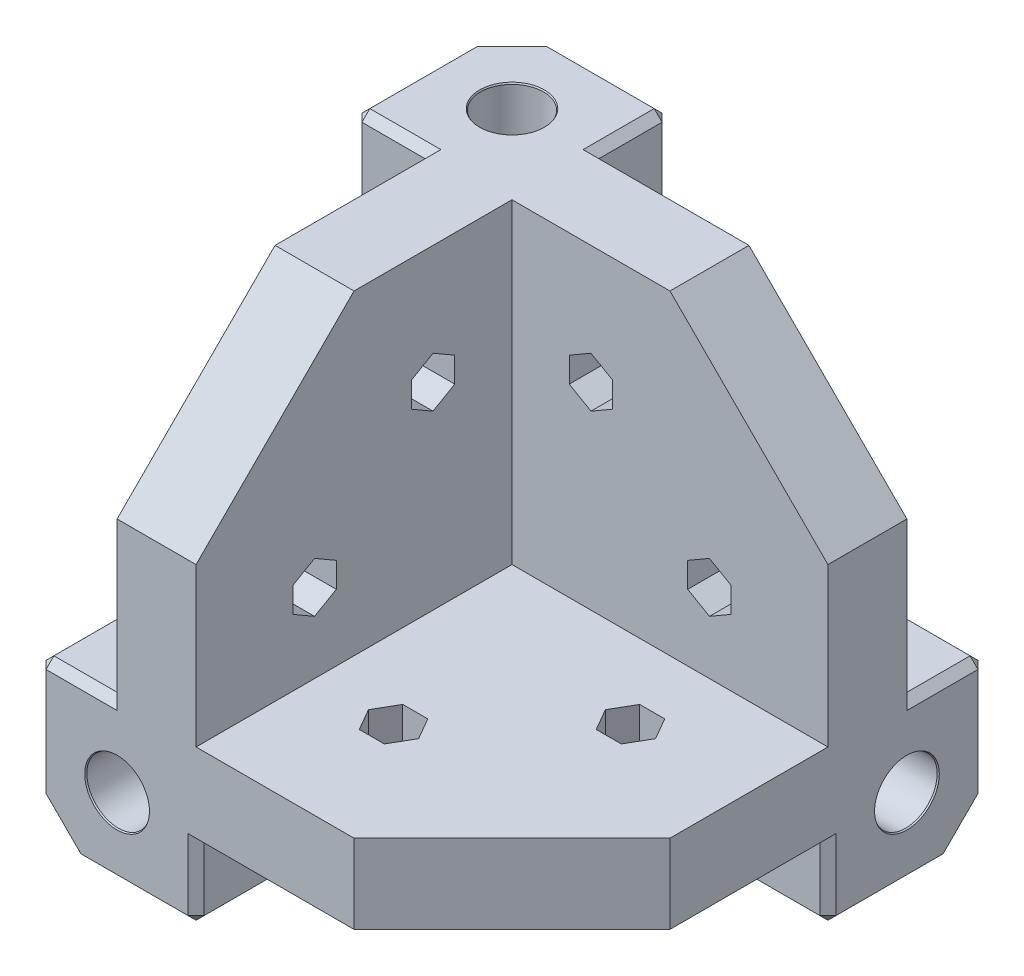
from build123d import *

# Parameters (mm, degrees)
BASE_SHAPE_BASE_DEPTH        = 20
BASE_SHAPE_EXTENSION_DEPTH   = 40
BASE_SHAPE_FINISH_SKETCH_W   = 10
BASE_SHAPE_FINISH_SKETCH_H   = 40
BASE_SHAPE_FINISH_DEPTH      = 40
ROD_HOLE_D8_Z_D              = 8
ROD_HOLE_D8_Z_DEPTH          = 40
ROD_HOLE_D8_Z_CSINK_D        = 8.2
ROD_HOLE_D8_Z_CSINK_ANGLE    = 60
ROD_HOLE_D8_Z_TIP            = 2.403442476
ROD_HOLE_D8_X_D              = 8
ROD_HOLE_D8_X_DEPTH          = 40
ROD_HOLE_D8_X_CSINK_D        = 8.2
ROD_HOLE_D8_X_CSINK_ANGLE    = 60
ROD_HOLE_D8_X_TIP            = 2.403442476
ROD_HOLE_D8_Y_D              = 8
ROD_HOLE_D8_Y_DEPTH          = 40
ROD_HOLE_D8_Y_CSINK_D        = 8.2
ROD_HOLE_D8_Y_CSINK_ANGLE    = 60
ROD_HOLE_D8_Y_TIP            = 2.403442476
OUTER_CHAMFERS_SIZE          = 5
INNER_SMALLER_CHAMFERS_SIZE  = 1
LARGE_CHAMFERS_SIZE          = 20
HULL_PART_HOLES_M3_START     = 10
HULL_PART_HOLES_M3_OUTLINE_R = 1.7
HULL_PART_HOLES_M3_DEPTH     = 10
HULL_PART_NUT_HOLE_DEPTH     = 5


# Read off the part's stored shape, not the designer's step: hull_part_holes_m3
with BuildPart() as part:
    # base_shape_sketch → base_shape_base (new body)
    with BuildSketch(Plane.XY):
        Polygon((0, 0), (60, 0), (60, 20), (20, 20), (20, 60), (0, 60), align=None)
    extrude(amount=BASE_SHAPE_BASE_DEPTH)

    # base_shape_extension_sketch → base_shape_extension (add)
    with BuildSketch(Plane.XY.offset(20)):
        Polygon((20, 60), (20, 20), (60, 20), (60, 10), (20, 10), (20, 0), (0, 0), (0, 20), (10, 20), (10, 60), align=None)
    extrude(amount=BASE_SHAPE_EXTENSION_DEPTH)

    # base_shape_finish_sketch → base_shape_finish (add)
    with BuildSketch(Plane(origin=(20, 0, 0), x_dir=(0, 0, -1), z_dir=(1, 0, 0))):
        with Locations((-15, 40)):
            Rectangle(BASE_SHAPE_FINISH_SKETCH_W, BASE_SHAPE_FINISH_SKETCH_H)
    extrude(amount=BASE_SHAPE_FINISH_DEPTH)

    # rod_hole_d8_z
    with Locations(Plane.XY.offset(60)):
        with Locations((10, 10)):
            CounterSinkHole(ROD_HOLE_D8_Z_D / 2, ROD_HOLE_D8_Z_CSINK_D / 2, depth=ROD_HOLE_D8_Z_DEPTH, counter_sink_angle=ROD_HOLE_D8_Z_CSINK_ANGLE)
            with Locations((0, 0, -(ROD_HOLE_D8_Z_DEPTH + ROD_HOLE_D8_Z_TIP / 2))):  # 118° drill point
                Cone(0, ROD_HOLE_D8_Z_D / 2, ROD_HOLE_D8_Z_TIP, mode=Mode.SUBTRACT)

    # rod_hole_d8_x
    with Locations(Plane(origin=(60, 0, 0), x_dir=(0, 0, -1), z_dir=(1, 0, 0))):
        with Locations((-10, 10)):
            CounterSinkHole(ROD_HOLE_D8_X_D / 2, ROD_HOLE_D8_X_CSINK_D / 2, depth=ROD_HOLE_D8_X_DEPTH, counter_sink_angle=ROD_HOLE_D8_X_CSINK_ANGLE)
            with Locations((0, 0, -(ROD_HOLE_D8_X_DEPTH + ROD_HOLE_D8_X_TIP / 2))):  # 118° drill point
                Cone(0, ROD_HOLE_D8_X_D / 2, ROD_HOLE_D8_X_TIP, mode=Mode.SUBTRACT)

    # rod_hole_d8_y
    with Locations(Plane(origin=(0, 60, 0), x_dir=(1, 0, 0), z_dir=(0, 1, 0))):
        with Locations((10, -10)):
            CounterSinkHole(ROD_HOLE_D8_Y_D / 2, ROD_HOLE_D8_Y_CSINK_D / 2, depth=ROD_HOLE_D8_Y_DEPTH, counter_sink_angle=ROD_HOLE_D8_Y_CSINK_ANGLE)
            with Locations((0, 0, -(ROD_HOLE_D8_Y_DEPTH + ROD_HOLE_D8_Y_TIP / 2))):  # 118° drill point
                Cone(0, ROD_HOLE_D8_Y_D / 2, ROD_HOLE_D8_Y_TIP, mode=Mode.SUBTRACT)

    # outer_chamfers
    outer_chamfers_edges = [part.edges().sort_by_distance(p)[0] for p in [
        (0, 0, 30),
        (30, 0, 0),
        (0, 30, 0),
    ]]
    chamfer(outer_chamfers_edges, length=OUTER_CHAMFERS_SIZE)

    # inner_smaller_chamfers
    inner_smaller_chamfers_edges = [part.edges().sort_by_distance(p)[0] for p in [
        (0, 60, 12.5),
        (60, 0, 12.5),
        (60, 5, 20),
        (40, 0, 20),
        (5, 60, 20),
        (0, 20, 40),
        (20, 0, 40),
        (5, 20, 60),
        (0, 12.5, 60),
        (20, 5, 60),
        (20, 60, 5),
        (0, 40, 20),
        (60, 20, 5),
        (12.5, 60, 0),
        (20, 40, 0),
        (40, 20, 0),
        (12.5, 0, 60),
        (2.5, 2.5, 60),
        (60, 12.5, 0),
        (60, 2.5, 2.5),
        (2.5, 60, 2.5),
    ]]
    chamfer(inner_smaller_chamfers_edges, length=INNER_SMALLER_CHAMFERS_SIZE)

    # large_chamfers
    large_chamfers_edges = [part.edges().sort_by_distance(p)[0] for p in [
        (15, 60, 60),
        (60, 15, 60),
        (60, 60, 15),
    ]]
    chamfer(large_chamfers_edges, length=LARGE_CHAMFERS_SIZE)

    # hull_part_holes_m3 outline → hull_part_holes_m3 (cut)
    with BuildSketch(Plane.YZ.offset(HULL_PART_HOLES_M3_START)):
        with Locations((45, 30)):
            Circle(HULL_PART_HOLES_M3_OUTLINE_R)
        with Locations((30, 45)):
            Circle(HULL_PART_HOLES_M3_OUTLINE_R)
    hull_part_holes_m3 = extrude(amount=HULL_PART_HOLES_M3_DEPTH, mode=Mode.SUBTRACT)

    # Sketch12 → hull_part_nut_hole (cut)
    with BuildSketch(Plane(origin=(20, 0, 0), x_dir=(0, 0, -1), z_dir=(1, 0, 0))):
        Polygon((-30, 48.175426481), (-32.75, 46.58771324), (-32.75, 43.41228676), (-30, 41.824573519), (-27.25, 43.41228676), (-27.25, 46.58771324), align=None)
        Polygon((-45, 33.175426481), (-47.75, 31.58771324), (-47.75, 28.41228676), (-45, 26.824573519), (-42.25, 28.41228676), (-42.25, 31.58771324), align=None)
    hull_part_nut_hole = extrude(amount=-HULL_PART_NUT_HOLE_DEPTH, mode=Mode.SUBTRACT)

    # hull_part_holes_mirror_x: hull_part_holes_m3, hull_part_nut_hole across plane
    add(hull_part_holes_m3.mirror(Plane(origin=(0, 0, 0), x_dir=(0.7071067811865482, 0, 0.7071067811865468), z_dir=(-0.707106781186547, 0, 0.7071067811865481))), mode=Mode.SUBTRACT)
    add(hull_part_nut_hole.mirror(Plane(origin=(0, 0, 0), x_dir=(0.7071067811865482, 0, 0.7071067811865468), z_dir=(-0.707106781186547, 0, 0.7071067811865481))), mode=Mode.SUBTRACT)

    # hull_part_holes_mirror_y: hull_part_holes_m3, hull_part_nut_hole across plane
    add(hull_part_holes_m3.mirror(Plane(origin=(0, 0, 0), x_dir=(0, 0, 1), z_dir=(-0.7071067811865482, 0.7071067811865469, 0))), mode=Mode.SUBTRACT)
    add(hull_part_nut_hole.mirror(Plane(origin=(0, 0, 0), x_dir=(0, 0, 1), z_dir=(-0.7071067811865482, 0.7071067811865469, 0))), mode=Mode.SUBTRACT)


solid = part.part
